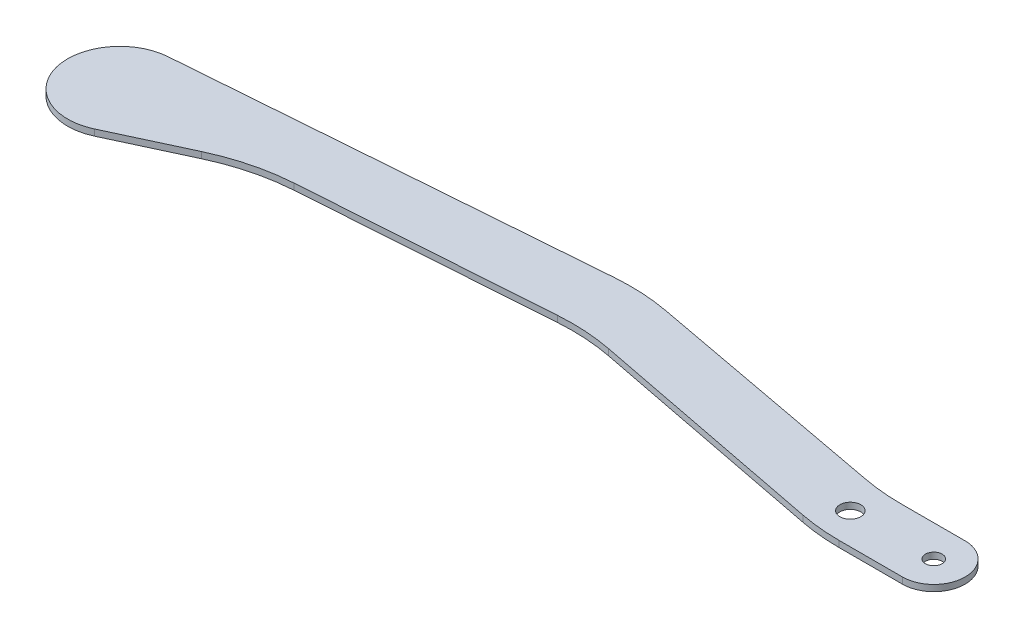
from build123d import *

# Parameters (mm, degrees)
SKETCH1_R           = 5
SKETCH1_R_2         = 4
BOSS_EXTRUDE1_DEPTH = 3
FILLET1_R           = 100


with BuildPart() as part:
    # Sketch1 → Boss-Extrude1 (new body)
    with BuildSketch(Plane(origin=(0, 0, 0), x_dir=(1, 0, 0), z_dir=(0, 1, 0))):
        with BuildLine():
            Line((-138.038674965, 11.836901239), (-5.523603874, -13.945959997))
            Line((-5.523603874, -13.945959997), (0, -15))
            Line((0, -15), (40, -15))
            ThreePointArc((40, -15), (55, 0), (40, 15))
            Line((40, 15), (0, 15))
            Line((0, 15), (-140.195256603, 41.228994112))
            Line((-140.195256603, 41.228994112), (-351.91932237, 24.926215149))
            ThreePointArc((-351.91932237, 24.926215149), (-374.185444558, -6.329634393), (-339.462597765, -22.670755482))
            Line((-339.462597765, -22.670755482), (-287.67514726, 1.400131663))
            Line((-287.67514726, 1.400131663), (-138.038674965, 11.836901239))
        make_face()
        Circle(SKETCH1_R, mode=Mode.SUBTRACT)
        with Locations((40, 0)):
            Circle(SKETCH1_R_2, mode=Mode.SUBTRACT)
    extrude(amount=BOSS_EXTRUDE1_DEPTH)

    # Fillet1
    fillet1_edges = [part.edges().sort_by_distance(p)[0] for p in [
        (0, 1.5, -15),
        (-140.195256603, 1.5, -41.228994112),
        (-138.038674965, 1.5, -11.836901239),
        (-287.67514726, 1.5, -1.400131663),
        (0, 1.5, 15),
    ]]
    fillet(fillet1_edges, radius=FILLET1_R)


solid = part.part
